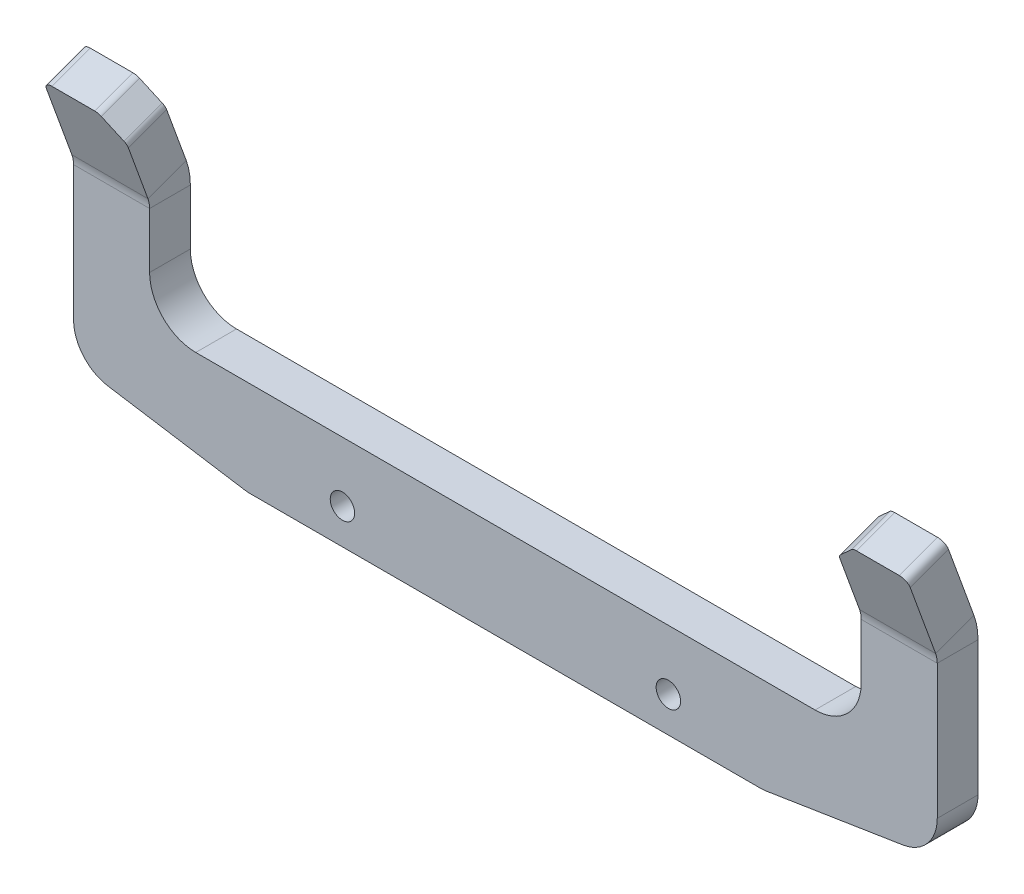
from build123d import *

# Parameters (mm, degrees)
SKETCH1_R              = 4.5
EXTRUDE1_DEPTH         = 15
PROCESS_BENDS1_START   = -159
PROCESS_BENDS1_DEPTH   = 318
PROCESS_BENDS1_2_DEPTH = 28
PROCESS_BENDS1_START_2 = 131
PROCESS_BENDS1_3_DEPTH = 28
PROCESS_BENDS1_START_3 = -0.699454706
PROCESS_BENDS1_4_DEPTH = 14.999999999
PROCESS_BENDS1_START_4 = 7.710911858
PROCESS_BENDS1_5_DEPTH = 6.589633435


with BuildPart() as part:
    # Sketch1 → Extrude1 (new body)
    with BuildSketch(Plane.XY):
        with BuildLine():
            Line((-114, 0), (114, 0))
            ThreePointArc((114, 0), (126.02081528, 4.97918472), (131, 17))
            Line((131, 17), (131, 63.757359313))
            ThreePointArc((131, 63.757359313), (131.228361402, 64.90540961), (131.878679656, 65.878679656))
            Line((131.878679656, 65.878679656), (138.121320344, 72.121320344))
            ThreePointArc((138.121320344, 72.121320344), (139.09459039, 72.771638598), (140.242640687, 73))
            Line((140.242640687, 73), (156, 73))
            ThreePointArc((156, 73), (158.121320344, 72.121320344), (159, 70))
            Line((159, 70), (159, -12.052185537))
            ThreePointArc((159, -12.052185537), (155.406089484, -21.793906262), (146.346516976, -26.867510646))
            Line((146.346516976, -26.867510646), (96.165991373, -34.815325109))
            ThreePointArc((96.165991373, -34.815325109), (94.996360834, -34.953760006), (93.819474398, -35))
            Line((93.819474398, -35), (-93.819474398, -35))
            ThreePointArc((-93.819474398, -35), (-94.996360834, -34.953760006), (-96.165991373, -34.815325109))
            Line((-96.165991373, -34.815325109), (-146.346516976, -26.867510646))
            ThreePointArc((-146.346516976, -26.867510646), (-155.406089484, -21.793906262), (-159, -12.052185537))
            Line((-159, -12.052185537), (-159, 70))
            ThreePointArc((-159, 70), (-158.121320344, 72.121320344), (-156, 73))
            Line((-156, 73), (-140.242640687, 73))
            ThreePointArc((-140.242640687, 73), (-139.09459039, 72.771638598), (-138.121320344, 72.121320344))
            Line((-138.121320344, 72.121320344), (-131.878679656, 65.878679656))
            ThreePointArc((-131.878679656, 65.878679656), (-131.228361402, 64.90540961), (-131, 63.757359313))
            Line((-131, 63.757359313), (-131, 17))
            ThreePointArc((-131, 17), (-126.02081528, 4.97918472), (-114, 0))
        make_face()
        with Locations((60, -22)):
            Circle(SKETCH1_R, mode=Mode.SUBTRACT)
        with Locations(Location((-60, -22, 0), (0, 0, 180))):
            Circle(SKETCH1_R, mode=Mode.SUBTRACT)
    extrude(amount=EXTRUDE1_DEPTH)

    # Process-Bends1: read off the stored shape, not the designer's step
    # Process-Bends1 outline → Process-Bends1 (cut)
    with BuildSketch(Plane.YZ.offset(PROCESS_BENDS1_START)):
        with BuildLine():
            Line((73, 0), (73, 11.351504666))
            Line((73, 11.351504666), (45.954326321, 1.50768448))
            ThreePointArc((45.954326321, 1.50768448), (41.745027179, 0.379806175), (37.403822738, 0))
            Line((37.403822738, 0), (73, 0))
        make_face()
    extrude(amount=PROCESS_BENDS1_DEPTH, mode=Mode.SUBTRACT)

    # Process-Bends1 2 outline → Process-Bends1 2 (add)
    with BuildSketch(Plane.YZ.offset(PROCESS_BENDS1_START)):
        with BuildLine():
            Line((74.524574191, 11.906404291), (69.394272041, 26.001793603))
            Line((69.394272041, 26.001793603), (40.824024171, 15.603073792))
            ThreePointArc((40.824024171, 15.603073792), (39.140304514, 15.15192247), (37.403822738, 15))
            Line((37.403822738, 15), (73, 15))
            Line((73, 15), (73, 11.351504666))
            Line((73, 11.351504666), (74.524574191, 11.906404291))
        make_face()
    extrude(amount=PROCESS_BENDS1_2_DEPTH)

    # Process-Bends1 3 outline → Process-Bends1 3 (add)
    with BuildSketch(Plane.YZ.offset(PROCESS_BENDS1_START_2)):
        with BuildLine():
            Line((74.524574191, 11.906404291), (69.394272041, 26.001793603))
            Line((69.394272041, 26.001793603), (40.824024171, 15.603073792))
            ThreePointArc((40.824024171, 15.603073792), (39.140304514, 15.15192247), (37.403822738, 15))
            Line((37.403822738, 15), (73, 15))
            Line((73, 15), (73, 11.351504666))
            Line((73, 11.351504666), (74.524574191, 11.906404291))
        make_face()
    extrude(amount=PROCESS_BENDS1_3_DEPTH)

    # Process-Bends1 4 outline → Process-Bends1 4 (cut)
    with BuildSketch(Plane(origin=(0, 0, 0), x_dir=(1, 0, 0), z_dir=(0, 0.34202014332567, -0.939692620785908)).offset(PROCESS_BENDS1_START_3)):
        with BuildLine():
            ThreePointArc((140.242640687, -74.102422537), (139.09459039, -73.874061134), (138.121320344, -73.22374288))
            Line((138.121320344, -73.22374288), (131.878679656, -66.981102193))
            ThreePointArc((131.878679656, -66.981102193), (131.228361402, -66.007832146), (131, -64.859781849))
            Line((131, -64.859781849), (131, -74.102422537))
            Line((131, -74.102422537), (140.242640687, -74.102422537))
        make_face()
        with BuildLine():
            ThreePointArc((159, -71.102422537), (158.121320344, -73.22374288), (156, -74.102422537))
            Line((156, -74.102422537), (159, -74.102422537))
            Line((159, -74.102422537), (160, -74.102422548))
            Line((160, -74.102422548), (160, -61))
            Line((160, -61), (159.000000001, -61))
            Line((159.000000001, -61), (159, -71.102422537))
        make_face()
        with BuildLine():
            Line((-140.242640687, -74.102422537), (-131, -74.102422537))
            Line((-131, -74.102422537), (-131, -64.859781849))
            ThreePointArc((-131, -64.859781849), (-131.228361402, -66.007832146), (-131.878679656, -66.981102193))
            Line((-131.878679656, -66.981102193), (-138.121320344, -73.22374288))
            ThreePointArc((-138.121320344, -73.22374288), (-139.09459039, -73.874061134), (-140.242640687, -74.102422537))
        make_face()
        with BuildLine():
            Line((-159, -74.102422537), (-156, -74.102422537))
            ThreePointArc((-156, -74.102422537), (-158.121320344, -73.22374288), (-159, -71.102422537))
            Line((-159, -71.102422537), (-159.000000001, -61))
            Line((-159.000000001, -61), (-160, -61))
            Line((-160, -61), (-160, -74.102422548))
            Line((-160, -74.102422548), (-159, -74.102422537))
        make_face()
    extrude(amount=PROCESS_BENDS1_4_DEPTH, mode=Mode.SUBTRACT)

    # Process-Bends1 5 outline → Process-Bends1 5 (add)
    with BuildSketch(Plane(origin=(0, 0, 0), x_dir=(1, 0, 0), z_dir=(0, 0.34202014332567, -0.939692620785908)).offset(PROCESS_BENDS1_START_4)):
        with BuildLine():
            Line((131.878679656, -66.981102193), (138.121320344, -73.22374288))
            ThreePointArc((138.121320344, -73.22374288), (139.09459039, -73.874061134), (140.242640687, -74.102422537))
            Line((140.242640687, -74.102422537), (156, -74.102422537))
            ThreePointArc((156, -74.102422537), (158.121320344, -73.22374288), (159, -71.102422537))
            Line((159, -71.102422537), (159.000000001, -61))
            Line((159.000000001, -61), (131.000000004, -61))
            Line((131.000000004, -61), (131, -64.859781849))
            ThreePointArc((131, -64.859781849), (131.228361402, -66.007832146), (131.878679656, -66.981102193))
        make_face()
        with BuildLine():
            ThreePointArc((-131.878679656, -66.981102193), (-131.228361402, -66.007832146), (-131, -64.859781849))
            Line((-131, -64.859781849), (-131, -61))
            Line((-131, -61), (-159.000000001, -61))
            Line((-159.000000001, -61), (-159, -71.102422537))
            ThreePointArc((-159, -71.102422537), (-158.121320344, -73.22374288), (-156, -74.102422537))
            Line((-156, -74.102422537), (-140.242640687, -74.102422537))
            ThreePointArc((-140.242640687, -74.102422537), (-139.09459039, -73.874061134), (-138.121320344, -73.22374288))
            Line((-138.121320344, -73.22374288), (-131.878679656, -66.981102193))
        make_face()
    extrude(amount=PROCESS_BENDS1_5_DEPTH)


solid = part.part
